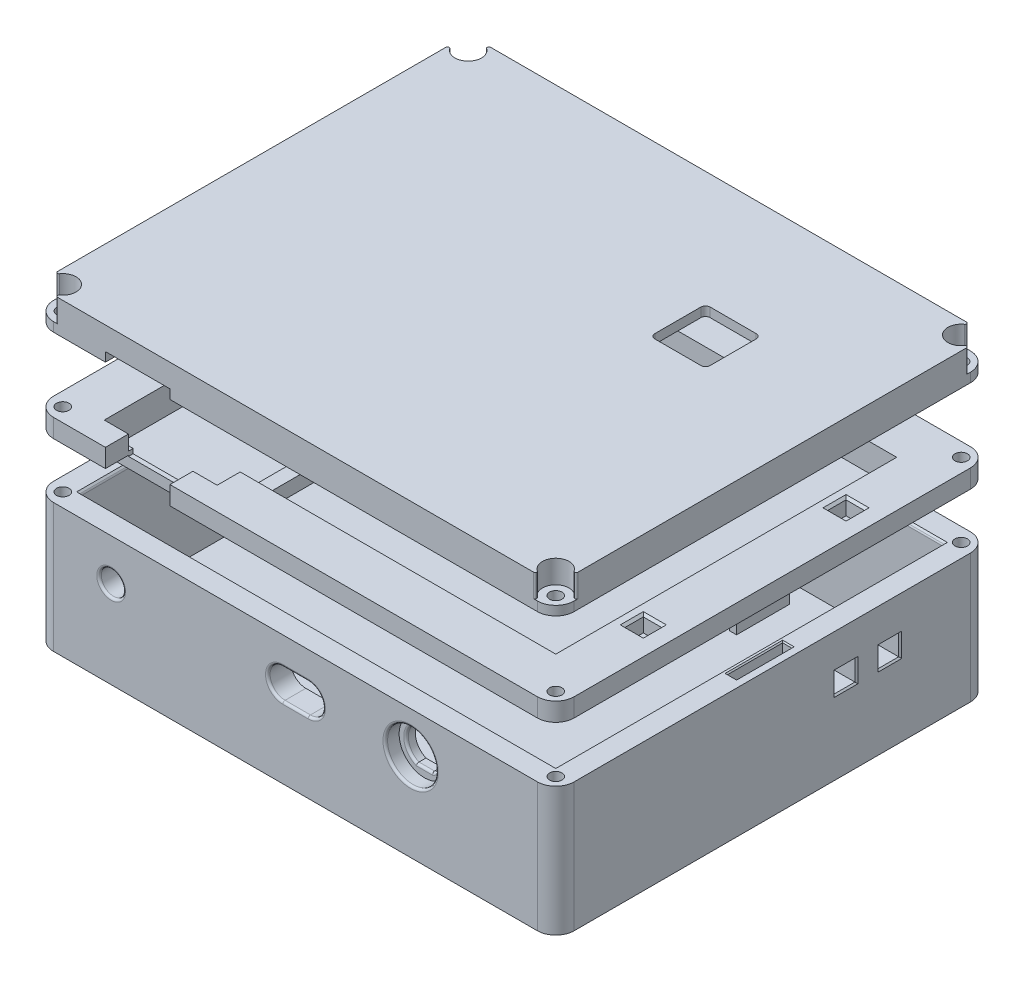
from build123d import *

# Parameters (mm, degrees)
BOSS_EXTRUDE1_DEPTH  = 4
BOSS_EXTRUDE2_START  = 4
SKETCH1_3_W          = 103
SKETCH1_3_H          = 84
BOSS_EXTRUDE2_DEPTH  = 24
BOSS_EXTRUDE3_START  = 4
SKETCH1_4_W          = 1.5
SKETCH1_4_H          = 12
SKETCH1_4_W_2        = 2.5
SKETCH1_4_H_2        = 1.5
BOSS_EXTRUDE3_DEPTH  = 8
CHAMFER1_SIZE        = 1
SKETCH2_R            = 2.625
CUT_EXTRUDE1_DEPTH   = 11
CUT_EXTRUDE2_START   = 5
SKETCH2_3_R          = 5.5
CUT_EXTRUDE2_DEPTH   = 3
CHAMFER2_SIZE        = 0.5
FILLET2_R            = 0.5
SKETCH3_R            = 1.35
CUT_EXTRUDE3_DEPTH   = 8
SKETCH3_3_W          = 2
SKETCH3_3_H          = 12
CUT_EXTRUDE12_DEPTH  = 4
SKETCH4_R            = 1.35
SKETCH4_W            = 103
SKETCH4_H            = 84
BOSS_EXTRUDE4_DEPTH  = 4
SKETCH4_5_W          = 1.5
SKETCH4_5_H          = 11.5
BOSS_EXTRUDE7_DEPTH  = 4
BOSS_EXTRUDE5_DEPTH  = 4
BOSS_EXTRUDE6_START  = -4
SKETCH4_4_W          = 93
SKETCH4_4_H          = 74
BOSS_EXTRUDE6_DEPTH  = 2
SKETCH5_W            = 24.5
SKETCH5_H            = 2
BOSS_EXTRUDE8_DEPTH  = 5
CHAMFER3_SIZE        = 1.5
SKETCH7_W            = 24.5
SKETCH7_H            = 3.053918574
BOSS_EXTRUDE11_DEPTH = 1
SKETCH6_W            = 14
SKETCH6_H            = 5.018415589
CUT_EXTRUDE4_DEPTH   = 7.5
BOSS_EXTRUDE12_DEPTH = 3
SKETCH8_3_W          = 16
SKETCH8_3_H          = 4
CUT_EXTRUDE5_DEPTH   = 3.5
CHAMFER4_SIZE        = 1
CUT_EXTRUDE6_START   = 6
SKETCH10_W           = 4
SKETCH10_H           = 4
CUT_EXTRUDE6_DEPTH   = 3.5
SKETCH10_3_R         = 0.8
BOSS_EXTRUDE13_DEPTH = 1.5
SKETCH10_4_W         = 2
SKETCH10_4_H         = 1.75
CUT_EXTRUDE7_DEPTH   = 2
FILLET3_R            = 0.5
CHAMFER5_SIZE        = 0.5
SKETCH12_W           = 3.3
SKETCH12_H           = 3.3
BOSS_EXTRUDE14_DEPTH = 5
SKETCH13_W           = 14
SKETCH13_H           = 2
CUT_EXTRUDE8_DEPTH   = 10
BOSS_EXTRUDE15_START = 5
SKETCH12_3_W         = 3.3
SKETCH12_3_H         = 3.3
BOSS_EXTRUDE15_DEPTH = 2
CUT_EXTRUDE9_START   = 7
SKETCH14_R           = 1.35
CUT_EXTRUDE9_DEPTH   = 7
CUT_EXTRUDE10_START  = 2
SKETCH14_3_R         = 2.875
CUT_EXTRUDE10_DEPTH  = 5
FILLET4_R            = 0.35
SKETCH17_R           = 5
CUT_EXTRUDE11_DEPTH  = 5
CHAMFER6_SIZE        = 0.25
FILLET5_R            = 1
FILLET6_R            = 0.5
SKETCH18_W           = 4.5
SKETCH18_H           = 4.5
CUT_EXTRUDE13_DEPTH  = 5
CHAMFER7_SIZE        = 0.325


with BuildPart() as part:
    # Sketch1 → Boss-Extrude1 (new body)
    with BuildSketch(Plane(origin=(0, 0, 0), x_dir=(1, 0, 0), z_dir=(0, 1, 0))):
        with BuildLine():
            Line((-1, 89), (104, 89))
            ThreePointArc((104, 89), (106.828427125, 87.828427125), (108, 85))
            Line((108, 85), (108, -1))
            ThreePointArc((108, -1), (106.828427125, -3.828427125), (104, -5))
            Line((104, -5), (-1, -5))
            ThreePointArc((-1, -5), (-3.828427125, -3.828427125), (-5, -1))
            Line((-5, -1), (-5, 85))
            ThreePointArc((-5, 85), (-3.828427125, 87.828427125), (-1, 89))
        make_face()
    extrude(amount=BOSS_EXTRUDE1_DEPTH)

    # Sketch1<3> → Boss-Extrude2 (add)
    with BuildSketch(Plane(origin=(0, 0, 0), x_dir=(1, 0, 0), z_dir=(0, 1, 0)).offset(BOSS_EXTRUDE2_START)):
        with BuildLine():
            Line((-1, 89), (104, 89))
            ThreePointArc((104, 89), (106.828427125, 87.828427125), (108, 85))
            Line((108, 85), (108, -1))
            ThreePointArc((108, -1), (106.828427125, -3.828427125), (104, -5))
            Line((104, -5), (-1, -5))
            ThreePointArc((-1, -5), (-3.828427125, -3.828427125), (-5, -1))
            Line((-5, -1), (-5, 85))
            ThreePointArc((-5, 85), (-3.828427125, 87.828427125), (-1, 89))
        make_face()
        with Locations((51.5, 42)):
            Rectangle(SKETCH1_3_W, SKETCH1_3_H, mode=Mode.SUBTRACT)
    extrude(amount=BOSS_EXTRUDE2_DEPTH)

    # Sketch1<4> → Boss-Extrude3 (add)
    with BuildSketch(Plane(origin=(0, 0, 0), x_dir=(1, 0, 0), z_dir=(0, 1, 0)).offset(BOSS_EXTRUDE3_START)):
        with Locations((0.75, 78)):
            Rectangle(SKETCH1_4_W, SKETCH1_4_H)
        Polygon((0, 13.5), (0, 0), (1.5, 0), (1.5, 1.5), (1.5, 13.5), align=None)
        with Locations((2.75, 0.75)):
            Rectangle(SKETCH1_4_W_2, SKETCH1_4_H_2)
    extrude(amount=BOSS_EXTRUDE3_DEPTH)

    # Chamfer1
    chamfer1_edges = [part.edges().sort_by_distance(p)[0] for p in [
        (0.75, 12, -72),
        (1.5, 12, -78),
        (1.5, 12, -7.5),
        (0.75, 12, -13.5),
        (4, 12, -0.75),
        (2.75, 12, -1.5),
    ]]
    chamfer(chamfer1_edges, length=CHAMFER1_SIZE)

    # Sketch2 → Cut-Extrude1 (cut)
    with BuildSketch(Plane.XY):
        with BuildLine():
            Line((48.75, 15.45), (54.25, 15.45))
            ThreePointArc((54.25, 15.45), (57.5, 18.7), (54.25, 21.95))
            Line((54.25, 21.95), (48.75, 21.95))
            ThreePointArc((48.75, 21.95), (45.5, 18.7), (48.75, 15.45))
        make_face()
        with BuildLine():
            Line((74.809031343, 15.375), (78.190968657, 15.375))
            ThreePointArc((78.190968657, 15.375), (80.5, 19), (78.190968657, 22.625))
            Line((78.190968657, 22.625), (74.809031343, 22.625))
            ThreePointArc((74.809031343, 22.625), (72.5, 19), (74.809031343, 15.375))
        make_face()
        with Locations(Location((11.5, 19, 0), (0, 0, 180))):
            Circle(SKETCH2_R)
    extrude(amount=CUT_EXTRUDE1_DEPTH, mode=Mode.SUBTRACT)

    # Sketch2<3> → Cut-Extrude2 (cut)
    with BuildSketch(Plane.XY.offset(CUT_EXTRUDE2_START)):
        with Locations(Location((76.5, 19, 0), (0, 0, 180))):
            Circle(SKETCH2_3_R)
    extrude(amount=-CUT_EXTRUDE2_DEPTH, mode=Mode.SUBTRACT)

    # Chamfer2
    chamfer2_edges = [part.edges().sort_by_distance(p)[0] for p in [
        (0, 28, -42),
        (51.5, 28, -84),
        (51.5, 28, 0),
        (103, 28, -42),
    ]]
    chamfer(chamfer2_edges, length=CHAMFER2_SIZE)

    # Fillet2
    fillet2_edges = [part.edges().sort_by_distance(p)[0] for p in [
        (45.5, 18.7, 5),
        (51.5, 21.95, 5),
        (57.5, 18.7, 5),
        (51.5, 15.45, 5),
        (14.125, 19, 5),
        (72.5, 19, 2),
        (80.5, 19, 2),
        (76.5, 15.375, 2),
        (82, 19, 5),
        (76.5, 22.625, 2),
    ]]
    fillet(fillet2_edges, radius=FILLET2_R)

    # Sketch3 → Cut-Extrude3 (cut)
    with BuildSketch(Plane(origin=(0, 28, 0), x_dir=(1, 0, 0), z_dir=(0, 1, 0))):
        with Locations(Location((-2, -2, 0), (0, 0, 270))):
            Circle(SKETCH3_R)
        with Locations(Location((105, -2, 0), (0, 0, 270))):
            Circle(SKETCH3_R)
        with Locations(Location((105, 86, 0), (0, 0, 270))):
            Circle(SKETCH3_R)
        with Locations(Location((-2, 86, 0), (0, 0, 270))):
            Circle(SKETCH3_R)
    extrude(amount=-CUT_EXTRUDE3_DEPTH, mode=Mode.SUBTRACT)

    # Sketch3<3> → Cut-Extrude12 (cut)
    with BuildSketch(Plane(origin=(0, 28, 0), x_dir=(1, 0, 0), z_dir=(0, 1, 0))):
        with Locations((-2.25, 42)):
            Rectangle(SKETCH3_3_W, SKETCH3_3_H)
        with Locations((105.25, 42)):
            Rectangle(SKETCH3_3_W, SKETCH3_3_H)
    extrude(amount=-CUT_EXTRUDE12_DEPTH, mode=Mode.SUBTRACT)

    # Sketch17 → Cut-Extrude11 (cut)
    with BuildSketch(Plane(origin=(0, 0, -89), x_dir=(-1, 0, 0), z_dir=(0, 0, -1))):
        with Locations((-68.25, 19)):
            Circle(SKETCH17_R)
    extrude(amount=-CUT_EXTRUDE11_DEPTH, mode=Mode.SUBTRACT)

    # Chamfer6
    chamfer6_edges = [part.edges().sort_by_distance(p)[0] for p in [
        (-1.25, 28, -42),
        (-2.25, 28, -36),
        (-2.25, 28, -48),
        (-3.25, 28, -42),
        (105.25, 28, -48),
        (106.25, 28, -42),
        (104.25, 28, -42),
        (105.25, 28, -36),
    ]]
    chamfer(chamfer6_edges, length=CHAMFER6_SIZE)

    # Fillet5
    fillet5_edges = [part.edges().sort_by_distance(p)[0] for p in [
        (73.25, 19, -84),
        (73.25, 19, -89),
    ]]
    fillet(fillet5_edges, radius=FILLET5_R)

    # Fillet6
    fillet6_edges = [part.edges().sort_by_distance(p)[0] for p in [
        (103, 27.5, -42),
        (51.5, 27.5, 0),
        (0, 27.5, -42),
        (51.5, 27.5, -84),
    ]]
    fillet(fillet6_edges, radius=FILLET6_R)

    # Sketch18 → Cut-Extrude13 (cut)
    with BuildSketch(Plane.ZY.offset(-103)):
        with Locations((-58, 18.213718009)):
            Rectangle(SKETCH18_W, SKETCH18_H)
        with Locations((-67.5, 18.213718009)):
            Rectangle(SKETCH18_W, SKETCH18_H)
    extrude(amount=-CUT_EXTRUDE13_DEPTH, mode=Mode.SUBTRACT)

    # Chamfer7
    chamfer7_edges = [part.edges().sort_by_distance(p)[0] for p in [
        (108, 20.463718009, -58),
        (103, 20.463718009, -58),
        (108, 18.213718009, -55.75),
        (103, 18.213718009, -55.75),
        (103, 18.213718009, -60.25),
        (103, 15.963718009, -58),
        (108, 15.963718009, -58),
        (108, 18.213718009, -60.25),
        (108, 20.463718009, -67.5),
        (103, 20.463718009, -67.5),
        (108, 18.213718009, -65.25),
        (103, 18.213718009, -65.25),
        (103, 18.213718009, -69.75),
        (103, 15.963718009, -67.5),
        (108, 15.963718009, -67.5),
        (108, 18.213718009, -69.75),
    ]]
    chamfer(chamfer7_edges, length=CHAMFER7_SIZE)


with BuildPart() as body_2:
    # Sketch4 → Boss-Extrude4 (new body)
    with BuildSketch(Plane(origin=(0, 40, 0), x_dir=(1, 0, 0), z_dir=(0, 1, 0))):
        with BuildLine():
            Line((104, 89), (-1, 89))
            ThreePointArc((-1, 89), (-3.828427125, 87.828427125), (-5, 85))
            Line((-5, 85), (-5, -1))
            ThreePointArc((-5, -1), (-3.828427125, -3.828427125), (-1, -5))
            Line((-1, -5), (104, -5))
            ThreePointArc((104, -5), (106.828427125, -3.828427125), (108, -1))
            Line((108, -1), (108, 85))
            ThreePointArc((108, 85), (106.828427125, 87.828427125), (104, 89))
        make_face()
        with Locations(Location((-2, -2, 0), (0, 0, 270))):
            Circle(SKETCH4_R, mode=Mode.SUBTRACT)
        with Locations(Location((105, -2, 0), (0, 0, 270))):
            Circle(SKETCH4_R, mode=Mode.SUBTRACT)
        with Locations(Location((105, 86, 0), (0, 0, 270))):
            Circle(SKETCH4_R, mode=Mode.SUBTRACT)
        with Locations(Location((-2, 86, 0), (0, 0, 270))):
            Circle(SKETCH4_R, mode=Mode.SUBTRACT)
        with Locations((51.5, 42)):
            Rectangle(SKETCH4_W, SKETCH4_H, mode=Mode.SUBTRACT)
    extrude(amount=BOSS_EXTRUDE4_DEPTH)

    # Sketch4<5> → Boss-Extrude7 (add)
    with BuildSketch(Plane(origin=(0, 40, 0), x_dir=(1, 0, 0), z_dir=(0, 1, 0))):
        with Locations((-2.25, 42)):
            Rectangle(SKETCH4_5_W, SKETCH4_5_H)
        with Locations((105.25, 42)):
            Rectangle(SKETCH4_5_W, SKETCH4_5_H)
    extrude(amount=-BOSS_EXTRUDE7_DEPTH)

    # Sketch4<3> → Boss-Extrude5 (add, symmetric)
    with BuildSketch(Plane(origin=(0, 40, 0), x_dir=(1, 0, 0), z_dir=(0, 1, 0))):
        Polygon((0, 84), (0, 0), (5, 0), (5, 5), (5, 79), (98, 79), (98, 5), (29.5, 5), (29.5, 0), (103, 0), (103, 84), align=None)
    extrude(amount=BOSS_EXTRUDE5_DEPTH, both=True)

    # Sketch4<4> → Boss-Extrude6 (add)
    with BuildSketch(Plane(origin=(0, 40, 0), x_dir=(1, 0, 0), z_dir=(0, 1, 0)).offset(BOSS_EXTRUDE6_START)):
        with Locations((51.5, 42)):
            Rectangle(SKETCH4_4_W, SKETCH4_4_H)
    extrude(amount=BOSS_EXTRUDE6_DEPTH)

    # Sketch5 → Boss-Extrude8 (add)
    with BuildSketch(Plane.XY.offset(-5)):
        with Locations((17.25, 37)):
            Rectangle(SKETCH5_W, SKETCH5_H)
    extrude(amount=BOSS_EXTRUDE8_DEPTH)

    # Chamfer3
    chamfer3_edges = [body_2.edges().sort_by_distance(p)[0] for p in [
        (51.5, 36, 0),
        (103, 36, -42),
        (51.5, 36, -84),
        (0, 36, -42),
    ]]
    chamfer(chamfer3_edges, length=CHAMFER3_SIZE)

    # Sketch7 → Boss-Extrude11 (add)
    with BuildSketch(Plane.XY):
        with Locations((17.25, 39.266777445)):
            Rectangle(SKETCH7_W, SKETCH7_H)
    extrude(amount=-BOSS_EXTRUDE11_DEPTH)

    # Sketch6 → Cut-Extrude4 (cut, symmetric)
    with BuildSketch(Plane.XY):
        with Locations((17.25, 42.309207795)):
            Rectangle(SKETCH6_W, SKETCH6_H)
    extrude(amount=CUT_EXTRUDE4_DEPTH, both=True, mode=Mode.SUBTRACT)

    # Sketch8 → Boss-Extrude12 (add)
    with BuildSketch(Plane(origin=(0, 38, 0), x_dir=(1, 0, 0), z_dir=(0, 1, 0))):
        Polygon((5, 48), (5, 44), (29.5, 44), (29.5, 5), (33.5, 5), (33.5, 48), align=None)
    extrude(amount=BOSS_EXTRUDE12_DEPTH)

    # Sketch8<3> → Cut-Extrude5 (cut)
    with BuildSketch(Plane(origin=(0, 38, 0), x_dir=(1, 0, 0), z_dir=(0, 1, 0))):
        with Locations((17.25, 54)):
            Rectangle(SKETCH8_3_W, SKETCH8_3_H)
    extrude(amount=-CUT_EXTRUDE5_DEPTH, mode=Mode.SUBTRACT)

    # Chamfer4
    chamfer4_edges = [body_2.edges().sort_by_distance(p)[0] for p in [
        (17.25, 41, -44),
        (29.5, 41, -24.5),
        (9.25, 38, -54),
        (17.25, 38, -56),
        (17.25, 38, -52),
        (25.25, 38, -54),
    ]]
    chamfer(chamfer4_edges, length=CHAMFER4_SIZE)

    # Sketch10 → Cut-Extrude6 (cut)
    with BuildSketch(Plane(origin=(0, 38, 0), x_dir=(1, 0, 0), z_dir=(0, 1, 0)).offset(CUT_EXTRUDE6_START)):
        with Locations((1, 20)):
            Rectangle(SKETCH10_W, SKETCH10_H)
        with Locations((102, 20)):
            Rectangle(SKETCH10_W, SKETCH10_H)
        with Locations((102, 64)):
            Rectangle(SKETCH10_W, SKETCH10_H)
        with Locations((1, 64)):
            Rectangle(SKETCH10_W, SKETCH10_H)
    extrude(amount=-CUT_EXTRUDE6_DEPTH, mode=Mode.SUBTRACT)

    # Sketch10<3> → Boss-Extrude13 (add)
    with BuildSketch(Plane(origin=(0, 38, 0), x_dir=(1, 0, 0), z_dir=(0, 1, 0))):
        with BuildLine():
            Line((81.5, 64), (73.5, 64))
            ThreePointArc((73.5, 64), (72.085786438, 63.414213562), (71.5, 62))
            Line((71.5, 62), (71.5, 61.375))
            Line((71.5, 61.375), (72.5, 61.375))
            Line((72.5, 61.375), (72.5, 59.625))
            Line((72.5, 59.625), (71.5, 59.625))
            Line((71.5, 59.625), (71.5, 56.375))
            Line((71.5, 56.375), (72.5, 56.375))
            Line((72.5, 56.375), (72.5, 54.625))
            Line((72.5, 54.625), (71.5, 54.625))
            Line((71.5, 54.625), (71.5, 54))
            ThreePointArc((71.5, 54), (72.085786438, 52.585786438), (73.5, 52))
            Line((73.5, 52), (81.5, 52))
            ThreePointArc((81.5, 52), (82.914213562, 52.585786438), (83.5, 54))
            Line((83.5, 54), (83.5, 54.625))
            Line((83.5, 54.625), (82.5, 54.625))
            Line((82.5, 54.625), (82.5, 56.375))
            Line((82.5, 56.375), (83.5, 56.375))
            Line((83.5, 56.375), (83.5, 59.625))
            Line((83.5, 59.625), (82.5, 59.625))
            Line((82.5, 59.625), (82.5, 61.375))
            Line((82.5, 61.375), (83.5, 61.375))
            Line((83.5, 61.375), (83.5, 62))
            ThreePointArc((83.5, 62), (82.914213562, 63.414213562), (81.5, 64))
        make_face()
        with Locations(Location((77.5, 53.65, 0), (0, 0, 270))):
            Circle(SKETCH10_3_R, mode=Mode.SUBTRACT)
        with Locations(Location((77.5, 62.35, 0), (0, 0, 270))):
            Circle(SKETCH10_3_R, mode=Mode.SUBTRACT)
    extrude(amount=BOSS_EXTRUDE13_DEPTH)

    # Sketch10<4> → Cut-Extrude7 (cut)
    with BuildSketch(Plane(origin=(0, 38, 0), x_dir=(1, 0, 0), z_dir=(0, 1, 0))):
        with Locations((71.5, 60.5)):
            Rectangle(SKETCH10_4_W, SKETCH10_4_H)
        with Locations((83.5, 60.5)):
            Rectangle(SKETCH10_4_W, SKETCH10_4_H)
        with Locations((71.5, 55.5)):
            Rectangle(SKETCH10_4_W, SKETCH10_4_H)
        with Locations((83.5, 55.5)):
            Rectangle(SKETCH10_4_W, SKETCH10_4_H)
    extrude(amount=-CUT_EXTRUDE7_DEPTH, mode=Mode.SUBTRACT)

    # Fillet3
    fillet3_edges = [body_2.edges().sort_by_distance(p)[0] for p in [
        (77.5, 39.5, -54.45),
        (77.5, 39.5, -63.15),
    ]]
    fillet(fillet3_edges, radius=FILLET3_R)

    # Chamfer5
    chamfer5_edges = [body_2.edges().sort_by_distance(p)[0] for p in [
        (1, 44, -62),
        (-1, 44, -64),
        (3, 44, -64),
        (1, 44, -66),
        (100, 44, -64),
        (102, 44, -66),
        (102, 44, -62),
        (104, 44, -64),
        (102, 44, -22),
        (104, 44, -20),
        (102, 44, -18),
        (100, 44, -20),
        (3, 44, -20),
        (1, 44, -18),
        (1, 44, -22),
        (-1, 44, -20),
    ]]
    chamfer(chamfer5_edges, length=CHAMFER5_SIZE)


with BuildPart() as body_3:
    # Sketch12 → Boss-Extrude14 (new body)
    with BuildSketch(Plane(origin=(0, 60, 0), x_dir=(1, 0, 0), z_dir=(0, 1, 0))):
        with BuildLine():
            Line((-5, 85), (-5, -1))
            ThreePointArc((-5, -1), (-3.828427125, -3.828427125), (-1, -5))
            Line((-1, -5), (10.25, -5))
            Line((10.25, -5), (10.25, 0))
            Line((10.25, 0), (5, 0))
            Line((5, 0), (5, 79))
            Line((5, 79), (98, 79))
            Line((98, 79), (98, 5))
            Line((98, 5), (29.5, 5))
            Line((29.5, 5), (29.5, 0))
            Line((29.5, 0), (24.25, 0))
            Line((24.25, 0), (24.25, -5))
            Line((24.25, -5), (104, -5))
            ThreePointArc((104, -5), (106.828427125, -3.828427125), (108, -1))
            Line((108, -1), (108, 85))
            ThreePointArc((108, 85), (106.828427125, 87.828427125), (104, 89))
            Line((104, 89), (-1, 89))
            ThreePointArc((-1, 89), (-3.828427125, 87.828427125), (-5, 85))
        make_face()
        Polygon((29.5, 0), (29.5, 5), (5, 5), (5, 0), (10.25, 0), (10.25, -5), (24.25, -5), (24.25, 0), align=None)
        with Locations((1, 64)):
            Rectangle(SKETCH12_W, SKETCH12_H)
        with Locations((1, 20)):
            Rectangle(SKETCH12_W, SKETCH12_H)
        with Locations((102, 20)):
            Rectangle(SKETCH12_W, SKETCH12_H)
        with Locations((102, 64)):
            Rectangle(SKETCH12_W, SKETCH12_H)
    extrude(amount=BOSS_EXTRUDE14_DEPTH)

    # Sketch13 → Cut-Extrude8 (cut)
    with BuildSketch(Plane.XY.offset(5)):
        with Locations((17.25, 61)):
            Rectangle(SKETCH13_W, SKETCH13_H)
    extrude(amount=-CUT_EXTRUDE8_DEPTH, mode=Mode.SUBTRACT)

    # Sketch12<3> → Boss-Extrude15 (add)
    # profile 1 of 7: a face of its own
    with BuildSketch(Plane(origin=(0, 60, 0), x_dir=(1, 0, 0), z_dir=(0, 1, 0)).offset(BOSS_EXTRUDE15_START)):
        Polygon((5, 5), (29.5, 5), (98, 5), (98, 79), (5, 79), align=None)
        with BuildLine():
            ThreePointArc((71.5, 63), (71.792893219, 63.707106781), (72.5, 64))
            Line((72.5, 64), (82.5, 64))
            ThreePointArc((82.5, 64), (83.207106781, 63.707106781), (83.5, 63))
            Line((83.5, 63), (83.5, 53))
            ThreePointArc((83.5, 53), (83.207106781, 52.292893219), (82.5, 52))
            Line((82.5, 52), (72.5, 52))
            ThreePointArc((72.5, 52), (71.792893219, 52.292893219), (71.5, 53))
            Line((71.5, 53), (71.5, 63))
        make_face(mode=Mode.SUBTRACT)
    # profile 2 of 7: a face of its own
    with BuildSketch(Plane(origin=(0, 60, 0), x_dir=(1, 0, 0), z_dir=(0, 1, 0)).offset(BOSS_EXTRUDE15_START)):
        with BuildLine():
            Line((-5, 85), (-5, -1))
            ThreePointArc((-5, -1), (-3.828427125, -3.828427125), (-1, -5))
            Line((-1, -5), (10.25, -5))
            Line((10.25, -5), (10.25, 0))
            Line((10.25, 0), (5, 0))
            Line((5, 0), (5, 79))
            Line((5, 79), (98, 79))
            Line((98, 79), (98, 5))
            Line((98, 5), (29.5, 5))
            Line((29.5, 5), (29.5, 0))
            Line((29.5, 0), (24.25, 0))
            Line((24.25, 0), (24.25, -5))
            Line((24.25, -5), (104, -5))
            ThreePointArc((104, -5), (106.828427125, -3.828427125), (108, -1))
            Line((108, -1), (108, 85))
            ThreePointArc((108, 85), (106.828427125, 87.828427125), (104, 89))
            Line((104, 89), (-1, 89))
            ThreePointArc((-1, 89), (-3.828427125, 87.828427125), (-5, 85))
        make_face()
        with Locations((1, 64)):
            Rectangle(SKETCH12_3_W, SKETCH12_3_H, mode=Mode.SUBTRACT)
        with Locations((1, 20)):
            Rectangle(SKETCH12_3_W, SKETCH12_3_H, mode=Mode.SUBTRACT)
        with Locations((102, 20)):
            Rectangle(SKETCH12_3_W, SKETCH12_3_H, mode=Mode.SUBTRACT)
        with Locations((102, 64)):
            Rectangle(SKETCH12_3_W, SKETCH12_3_H, mode=Mode.SUBTRACT)
    # profile 3 of 7: a face of its own
    with BuildSketch(Plane(origin=(0, 60, 0), x_dir=(1, 0, 0), z_dir=(0, 1, 0)).offset(BOSS_EXTRUDE15_START)):
        Polygon((29.5, 0), (29.5, 5), (5, 5), (5, 0), (10.25, 0), (10.25, -5), (24.25, -5), (24.25, 0), align=None)
    # profile 4 of 7: a face of its own
    with BuildSketch(Plane(origin=(0, 60, 0), x_dir=(1, 0, 0), z_dir=(0, 1, 0)).offset(BOSS_EXTRUDE15_START)):
        with Locations((1, 20)):
            Rectangle(SKETCH12_3_W, SKETCH12_3_H)
    # profile 5 of 7: a face of its own
    with BuildSketch(Plane(origin=(0, 60, 0), x_dir=(1, 0, 0), z_dir=(0, 1, 0)).offset(BOSS_EXTRUDE15_START)):
        with Locations((1, 64)):
            Rectangle(SKETCH12_3_W, SKETCH12_3_H)
    # profile 6 of 7: a face of its own
    with BuildSketch(Plane(origin=(0, 60, 0), x_dir=(1, 0, 0), z_dir=(0, 1, 0)).offset(BOSS_EXTRUDE15_START)):
        with Locations((102, 64)):
            Rectangle(SKETCH12_3_W, SKETCH12_3_H)
    # profile 7 of 7: a face of its own
    with BuildSketch(Plane(origin=(0, 60, 0), x_dir=(1, 0, 0), z_dir=(0, 1, 0)).offset(BOSS_EXTRUDE15_START)):
        with Locations((102, 20)):
            Rectangle(SKETCH12_3_W, SKETCH12_3_H)
    extrude(amount=BOSS_EXTRUDE15_DEPTH)

    # Sketch14 → Cut-Extrude9 (cut)
    with BuildSketch(Plane(origin=(0, 60, 0), x_dir=(1, 0, 0), z_dir=(0, 1, 0)).offset(CUT_EXTRUDE9_START)):
        with Locations(Location((-2, 86, 0), (0, 0, 270))):
            Circle(SKETCH14_R)
        with Locations(Location((105, 86, 0), (0, 0, 270))):
            Circle(SKETCH14_R)
        with Locations(Location((105, -2, 0), (0, 0, 270))):
            Circle(SKETCH14_R)
        with Locations(Location((-2, -2, 0), (0, 0, 270))):
            Circle(SKETCH14_R)
    extrude(amount=-CUT_EXTRUDE9_DEPTH, mode=Mode.SUBTRACT)

    # Sketch14<3> → Cut-Extrude10 (cut)
    with BuildSketch(Plane(origin=(0, 60, 0), x_dir=(1, 0, 0), z_dir=(0, 1, 0)).offset(CUT_EXTRUDE10_START)):
        with Locations((-2, -2)):
            Circle(SKETCH14_3_R)
        with Locations((-2, 86)):
            Circle(SKETCH14_3_R)
        with Locations((105, 86)):
            Circle(SKETCH14_3_R)
        with Locations((105, -2)):
            Circle(SKETCH14_3_R)
    extrude(amount=CUT_EXTRUDE10_DEPTH, mode=Mode.SUBTRACT)

    # Fillet4
    # the kernel refuses this fillet: 0.35 mm, written as the material it takes off along each edge
    with BuildSketch(Plane(origin=(-1.992198086, 71.586075519, -88.874989414), x_dir=(0.953980037555778, 0, 0.29987011845976974), z_dir=(0, -1, 0)), Plane(origin=(107.874989414, 71.586075519, -85.992198086), x_dir=(-0.29987011845981965, 0, 0.9539800375557623), z_dir=(0, -1, 0)), Plane(origin=(104.992198086, 71.586075519, 4.874989414), x_dir=(-0.9539800375557725, 0, -0.299870118459787), z_dir=(0, -1, 0)), Plane(origin=(-4.874989414, 71.586075519, 1.992198086), x_dir=(0.299870118459802, 0, -0.9539800375557679), z_dir=(0, -1, 0))) as fillet4_piece_1:
        with BuildLine():
            CenterArc((1.813409158, -0.3341766), FILLET4_R, 107.294318033, 145.25587966)
            Line((1.708454617, -0.668069613), (1.697959163, -0.701458914))
            ThreePointArc((1.697959163, -0.701458914), (0.898554774, -0.450177463), (-0.018449644, -0.029742405))
            Line((-0.018449644, -0.029742405), (0.010404807, 0.03341766))
            ThreePointArc((0.010404807, 0.03341766), (0.854680546, -0.09497793), (1.698956285, 0.03341766))
            Line((1.698956285, 0.03341766), (1.709361092, 0))
        make_face()
    extrude(amount=9.586075519, mode=Mode.SUBTRACT)
    with BuildSketch(Plane(origin=(-4.874989414, 71.586075519, -85.992198086), x_dir=(0.299870118459794, 0, 0.9539800375557703), z_dir=(0, -1, 0)), Plane(origin=(104.992198086, 71.586075519, -88.874989414), x_dir=(-0.9539800375557763, 0, 0.2998701184597751), z_dir=(0, -1, 0)), Plane(origin=(107.874989414, 71.586075519, 1.992198086), x_dir=(-0.29987011845981637, 0, -0.9539800375557634), z_dir=(0, -1, 0)), Plane(origin=(-1.992198086, 71.586075519, 4.874989414), x_dir=(0.9539800375557679, 0, -0.29987011845980177), z_dir=(0, -1, 0))) as fillet4_piece_2:
        with BuildLine():
            CenterArc((1.813409158, 0.3341766), FILLET4_R, 107.449802307, 145.25587966)
            Line((1.708454617, 0.668069613), (1.697959163, 0.701458914))
            ThreePointArc((1.697959163, 0.701458914), (0.898554774, 0.450177463), (-0.018449644, 0.029742405))
            Line((-0.018449644, 0.029742405), (0.010404807, -0.03341766))
            ThreePointArc((0.010404807, -0.03341766), (0.854680546, 0.09497793), (1.698956285, -0.03341766))
            Line((1.698956285, -0.03341766), (1.709361092, 0))
        make_face()
    extrude(amount=9.586075519, mode=Mode.SUBTRACT)


solid = Compound([part.part, body_2.part, body_3.part])
